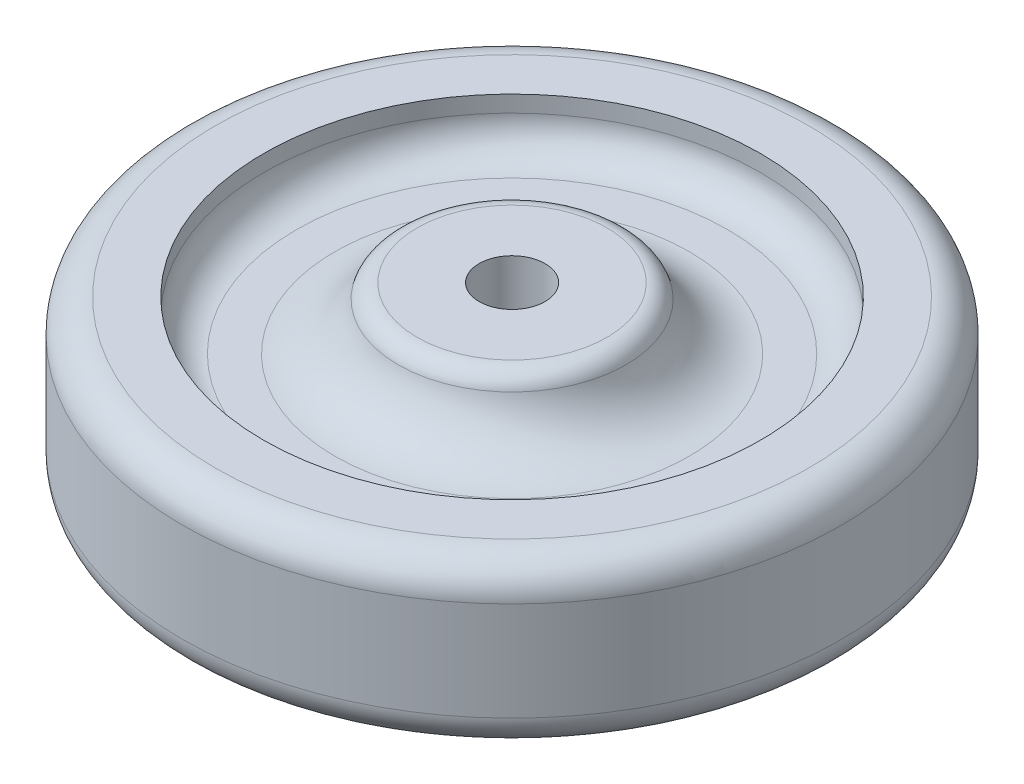
from build123d import *

# Parameters (mm, degrees)
BOSS_EXTRUDE4_DEPTH      = 15.875
BOSS_EXTRUDE4_DEPTH_BACK = 15.875
SKETCH1_R                = 63.5
SKETCH1_R_2              = 47.864471796
BOSS_EXTRUDE5_DEPTH      = 18.25625
BOSS_EXTRUDE5_DEPTH_BACK = 18.25625
SKETCH1_9_R              = 21.469426169
SKETCH1_9_R_2            = 6.35
BOSS_EXTRUDE6_DEPTH      = 6.35
BOSS_EXTRUDE6_DEPTH_BACK = 6.35
SKETCH1_10_R             = 47.864471796
SKETCH1_10_R_2           = 21.469426169
FILLET1_R                = 6.35
FILLET2_R                = 6.35
FILLET2_R_2              = 12.7
FILLET3_R                = 3.81


with BuildPart() as part:
    # Sketch1 → Boss-Extrude4 (new, two sides: drawn at the far end of the back side and taken through both)
    with BuildSketch(Plane(origin=(0, 0, 0), x_dir=(1, 0, 0), z_dir=(0, 1, 0)).offset(-BOSS_EXTRUDE4_DEPTH_BACK)):
        with Locations(Location((0, 0, 0), (0, 0, 270))):
            Circle(SKETCH1_R)
        with Locations(Location((0, 0, 0), (0, 0, 270))):
            Circle(SKETCH1_R_2, mode=Mode.SUBTRACT)
    extrude(amount=BOSS_EXTRUDE4_DEPTH + BOSS_EXTRUDE4_DEPTH_BACK)



with BuildPart() as body_2:
    # Sketch1<9> → Boss-Extrude5 (new, two sides: drawn at the far end of the back side and taken through both)
    with BuildSketch(Plane(origin=(0, 0, 0), x_dir=(1, 0, 0), z_dir=(0, 1, 0)).offset(-BOSS_EXTRUDE5_DEPTH_BACK)):
        with Locations(Location((0, 0, 0), (0, 0, 270))):
            Circle(SKETCH1_9_R)
        with Locations(Location((0, 0, 0), (0, 0, 270))):
            Circle(SKETCH1_9_R_2, mode=Mode.SUBTRACT)
    extrude(amount=BOSS_EXTRUDE5_DEPTH + BOSS_EXTRUDE5_DEPTH_BACK)


with BuildPart() as part_1:
    add(part.part)

    add(body_2.part)  # Boss-Extrude6 merges body 2
    # Sketch1<10> → Boss-Extrude6 (add, two sides: drawn at the far end of the back side and taken through both)
    with BuildSketch(Plane(origin=(0, 0, 0), x_dir=(1, 0, 0), z_dir=(0, 1, 0)).offset(-BOSS_EXTRUDE6_DEPTH_BACK)):
        with Locations(Location((0, 0, 0), (0, 0, 270))):
            Circle(SKETCH1_10_R)
        with Locations(Location((0, 0, 0), (0, 0, 270))):
            Circle(SKETCH1_10_R_2, mode=Mode.SUBTRACT)
    extrude(amount=BOSS_EXTRUDE6_DEPTH + BOSS_EXTRUDE6_DEPTH_BACK)

    # Fillet1
    fillet1_edges = [part_1.edges().sort_by_distance(p)[0] for p in [
        (0, -15.875, -63.5),
        (0, 15.875, -63.5),
    ]]
    fillet(fillet1_edges, radius=FILLET1_R)

    # Fillet2
    # the kernel refuses this fillet: 12.7, 6.35 mm, written as the material it adds along each edge
    with BuildSketch(Plane(origin=(0, -6.35, 0), x_dir=(0, 0, 1), z_dir=(-1, 0, 0))) as fillet2_piece_1:
        with BuildLine():
            CenterArc((47.864471796 - FILLET2_R, -FILLET2_R), FILLET2_R, 0, 90)
            Line((47.864471796 - FILLET2_R, 0), (47.864471796 - FILLET2_R, FILLET2_R * 0.02))
            Line((47.864471796 - FILLET2_R, FILLET2_R * 0.02), (47.864471796 + FILLET2_R * 0.02, FILLET2_R * 0.02))
            Line((47.864471796 + FILLET2_R * 0.02, FILLET2_R * 0.02), (47.864471796 + FILLET2_R * 0.02, -FILLET2_R))
            Line((47.864471796 + FILLET2_R * 0.02, -FILLET2_R), (47.864471796, -FILLET2_R))
        make_face()
    revolve(axis=Axis((0, -6.35, 0), (0, 1, 0)))
    with BuildSketch(Plane(origin=(0, 6.35, 0), x_dir=(0, 0, 1), z_dir=(-1, 0, 0))) as fillet2_piece_2:
        with BuildLine():
            CenterArc((47.864471796 - FILLET2_R, FILLET2_R), FILLET2_R, 270, 90)
            Line((47.864471796 - FILLET2_R, 0), (47.864471796 - FILLET2_R, -FILLET2_R * 0.02))
            Line((47.864471796 - FILLET2_R, -FILLET2_R * 0.02), (47.864471796 + FILLET2_R * 0.02, -FILLET2_R * 0.02))
            Line((47.864471796 + FILLET2_R * 0.02, -FILLET2_R * 0.02), (47.864471796 + FILLET2_R * 0.02, FILLET2_R))
            Line((47.864471796 + FILLET2_R * 0.02, FILLET2_R), (47.864471796, FILLET2_R))
        make_face()
    revolve(axis=Axis((0, 6.35, 0), (0, 1, 0)))
    with BuildSketch(Plane(origin=(0, -6.35, 0), x_dir=(0, 0, 1), z_dir=(-1, 0, 0))) as fillet2_piece_3:
        with BuildLine():
            CenterArc((34.144597211, -12.7), FILLET2_R_2, 90, 86.416678302)
            Line((21.469426169, -11.90625), (21.215922748, -11.890375))
            ThreePointArc((21.215922748, -11.890375), (21.215426169, -5.953125), (21.215426169, 0))
            Line((21.215426169, 0), (21.469426169, 0.254))
            Line((21.469426169, 0.254), (34.144597211, 0.254))
            Line((34.144597211, 0.254), (34.144597211, 0))
        make_face()
    revolve(axis=Axis((0, -6.35, 0), (0, 1, 0)))
    with BuildSketch(Plane(origin=(0, 6.35, 0), x_dir=(0, 0, 1), z_dir=(-1, 0, 0))) as fillet2_piece_4:
        with BuildLine():
            CenterArc((34.144597211, 12.7), FILLET2_R_2, 183.583321698, 86.416678302)
            Line((21.469426169, 11.90625), (21.215922748, 11.890375))
            ThreePointArc((21.215922748, 11.890375), (21.215426169, 5.953125), (21.215426169, 0))
            Line((21.215426169, 0), (21.469426169, -0.254))
            Line((21.469426169, -0.254), (34.144597211, -0.254))
            Line((34.144597211, -0.254), (34.144597211, 0))
        make_face()
    revolve(axis=Axis((0, 6.35, 0), (0, 1, 0)))

    # Fillet3
    fillet3_edges = [part_1.edges().sort_by_distance(p)[0] for p in [
        (0, -18.25625, -21.469426169),
        (0, 18.25625, -21.469426169),
    ]]
    fillet(fillet3_edges, radius=FILLET3_R)


solid = part_1.part
